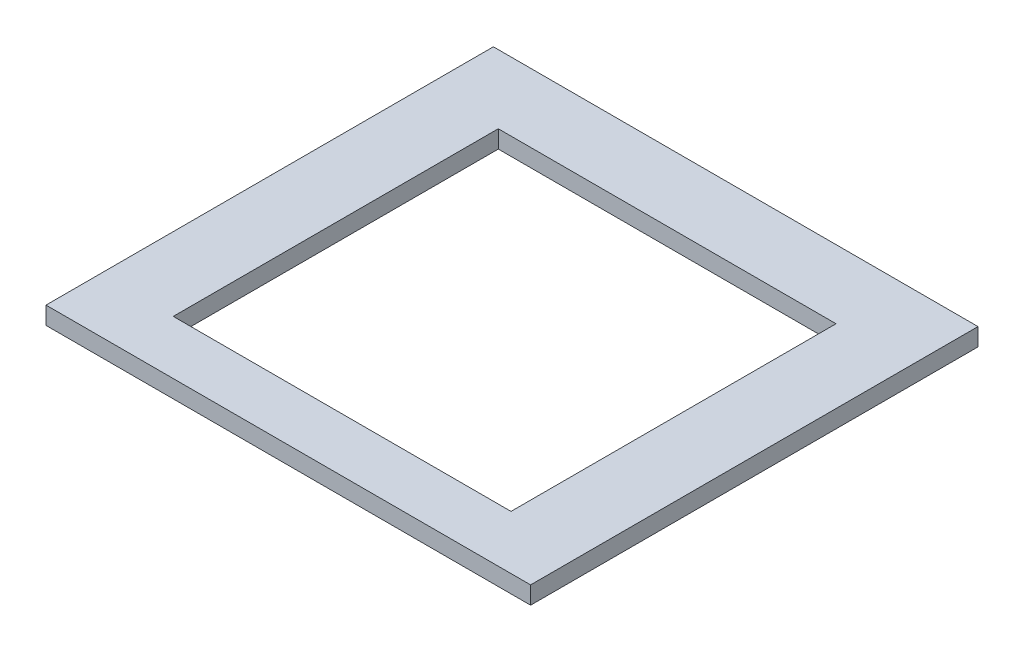
from build123d import *

# Parameters (mm, degrees)
SKETCH1_W           = 495
SKETCH1_H           = 457
SKETCH1_W_2         = 345
SKETCH1_H_2         = 332
BOSS_EXTRUDE1_DEPTH = 18


with BuildPart() as part:
    # Sketch1 → Boss-Extrude1 (new body)
    with BuildSketch(Plane(origin=(0, 0, 0), x_dir=(1, 0, 0), z_dir=(0, 1, 0))):
        with Locations((247.5, 228.5)):
            Rectangle(SKETCH1_W, SKETCH1_H)
        with Locations((247.5, 221)):
            Rectangle(SKETCH1_W_2, SKETCH1_H_2, mode=Mode.SUBTRACT)
    extrude(amount=BOSS_EXTRUDE1_DEPTH)


solid = part.part
